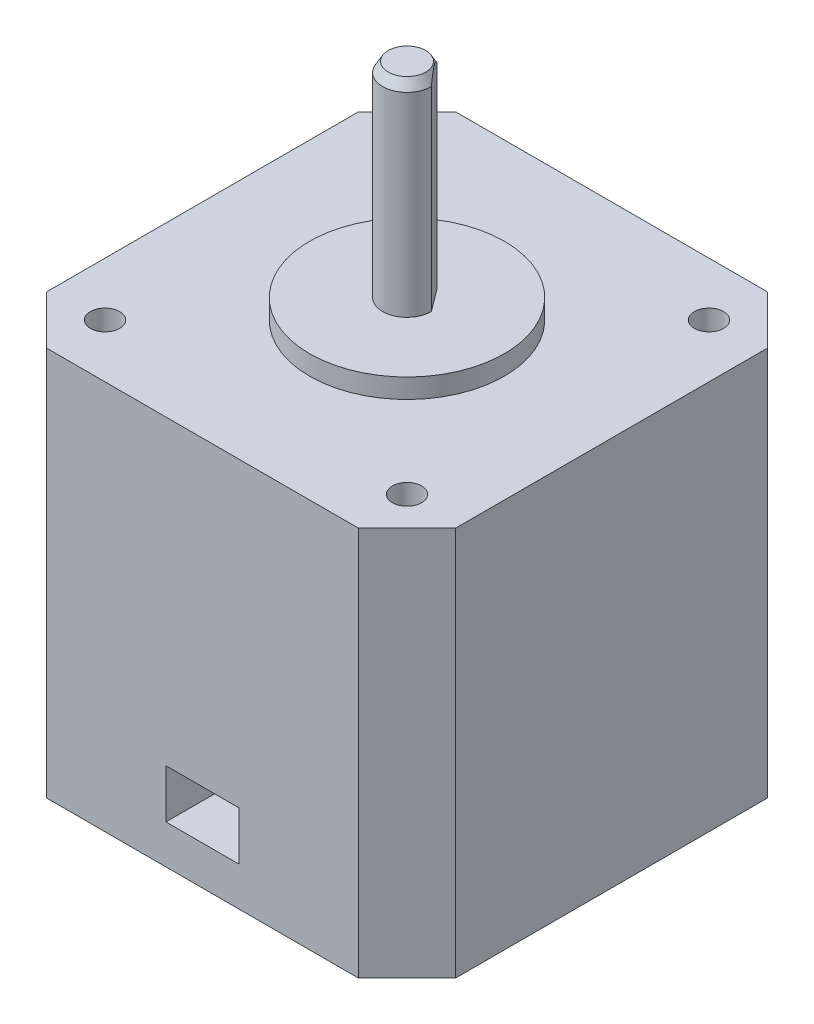
from build123d import *

# Parameters (mm, degrees)
SKETCH1_W                 = 42
SKETCH1_H                 = 42
BOSS_EXTRUDE1_DEPTH       = 40
F_3_0MM_DOWEL_HOLE1_D     = 3
F_3_0MM_DOWEL_HOLE1_DEPTH = 4.5
F_3_0MM_DOWEL_HOLE1_TIP   = 0.901290929
SKETCH2_R                 = 10
BOSS_EXTRUDE2_DEPTH       = 2
BOSS_EXTRUDE3_DEPTH       = 23
SKETCH10_W                = 7.5
SKETCH10_H                = 5
CUT_EXTRUDE1_DEPTH        = 5
CHAMFER2_SIZE             = 5


with BuildPart() as part:
    # Sketch1 → Boss-Extrude1 (new body)
    with BuildSketch(Plane(origin=(0, 0, 0), x_dir=(1, 0, 0), z_dir=(0, 1, 0))):
        Rectangle(SKETCH1_W, SKETCH1_H)
    extrude(amount=BOSS_EXTRUDE1_DEPTH)

    # Ø3.0mm Dowel Hole1
    with Locations(Plane(origin=(0, 40, 0), x_dir=(1, 0, 0), z_dir=(0, 1, 0))):
        with Locations((-15.5, 15.5), (15.5, 15.5), (15.5, -15.5), (-15.5, -15.5)):
            Hole(F_3_0MM_DOWEL_HOLE1_D / 2, depth=F_3_0MM_DOWEL_HOLE1_DEPTH)
            with Locations((0, 0, -(F_3_0MM_DOWEL_HOLE1_DEPTH + F_3_0MM_DOWEL_HOLE1_TIP / 2))):  # 118° drill point
                Cone(0, F_3_0MM_DOWEL_HOLE1_D / 2, F_3_0MM_DOWEL_HOLE1_TIP, mode=Mode.SUBTRACT)

    # Sketch2 → Boss-Extrude2 (add)
    with BuildSketch(Plane(origin=(0, 40, 0), x_dir=(1, 0, 0), z_dir=(0, 1, 0))):
        with Locations(Location((0, 0, 0), (0, 0, 90))):
            Circle(SKETCH2_R)
    extrude(amount=BOSS_EXTRUDE2_DEPTH)

    # Sketch4 → Boss-Extrude3 (add)
    with BuildSketch(Plane(origin=(0, 40, 0), x_dir=(1, 0, 0), z_dir=(0, 1, 0))):
        with BuildLine():
            Line((0.7, 2.4), (2.5, 0))
            ThreePointArc((2.5, 0), (-2, -1.5), (0.7, 2.4))
        make_face()
    extrude(amount=BOSS_EXTRUDE3_DEPTH)

    # Sketch10 → Cut-Extrude1 (cut)
    with BuildSketch(Plane.XY.offset(21)):
        with Locations((0, 6.5)):
            Rectangle(SKETCH10_W, SKETCH10_H)
    extrude(amount=-CUT_EXTRUDE1_DEPTH, mode=Mode.SUBTRACT)

    # Chamfer1: read off the stored shape, not the designer's step
    # Chamfer1 outline → Chamfer1 (revolve, cut)
    with BuildSketch(Plane.XY):
        Polygon((2.5, 63), (1.922649731, 63), (2.5, 62), align=None)
    revolve(axis=Axis((0, 0, 0), (0, 1, 0)), mode=Mode.SUBTRACT)

    # Chamfer2
    chamfer2_edges = [part.edges().sort_by_distance(p)[0] for p in [
        (21, 20, 21),
        (-21, 20, 21),
        (-21, 20, -21),
        (21, 20, -21),
    ]]
    chamfer(chamfer2_edges, length=CHAMFER2_SIZE)


solid = part.part
